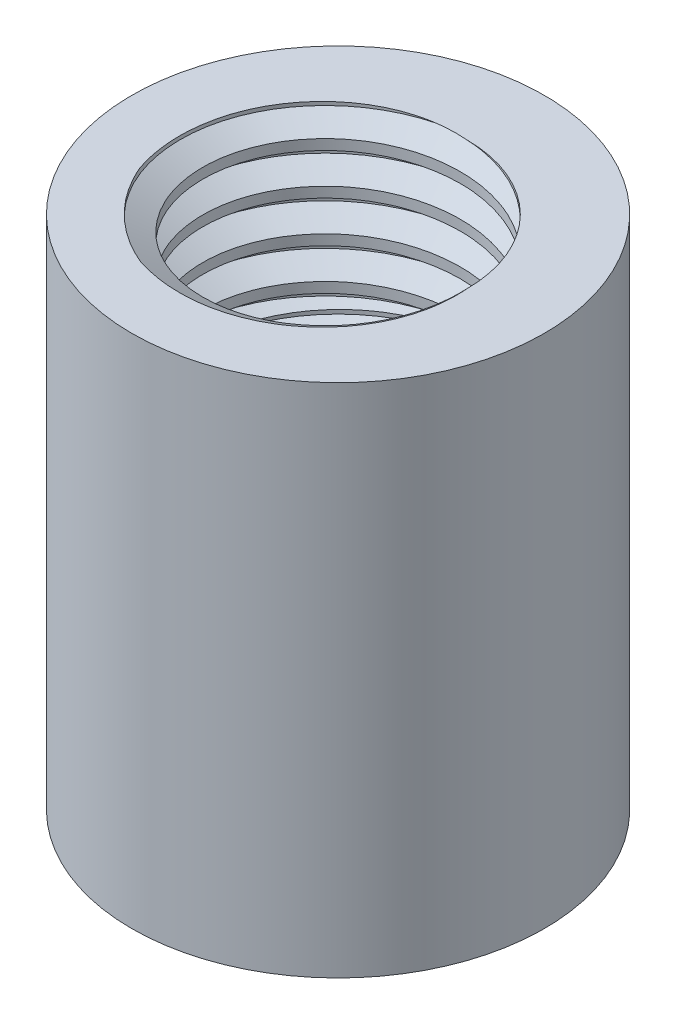
from build123d import *

# Parameters (mm, degrees)
SKETCH1_R           = 4
BOSS_EXTRUDE1_DEPTH = 10
SKETCH2_R           = 2.5
CUT_EXTRUDE1_DEPTH  = 4
THREAD1_PITCH       = 0.8
CUT_EXTRUDE2_START  = -4
CUT_EXTRUDE2_DEPTH  = 4


with BuildPart() as part:
    # Sketch1 → Boss-Extrude1 (new body)
    with BuildSketch(Plane(origin=(0, 0, 0), x_dir=(1, 0, 0), z_dir=(0, 1, 0))):
        with Locations(Location((0, 0, 0), (0, 0, 270))):
            Circle(SKETCH1_R)
    extrude(amount=BOSS_EXTRUDE1_DEPTH)

    # Sketch2 → Cut-Extrude1 (cut)
    with BuildSketch(Plane(origin=(0, 10, 0), x_dir=(1, 0, 0), z_dir=(0, 1, 0))):
        with Locations(Location((0, 0, 0), (0, 0, 270))):
            Circle(SKETCH2_R)
    extrude(amount=-CUT_EXTRUDE1_DEPTH, mode=Mode.SUBTRACT)

    # Thread1: the profile of Thread Profile1 profile screwed along a right-hand helix of 25 turns, 8 arcs to a turn; built about Z, then put on its axis
    thread1_z = Axis((0, 0, 0), (0, 0, 1))
    thread1_corners = [(2.4997, 0, -0.000173205), (2.9330127, 0, 0.249999999), (2.9330127, 0, 0.349999999), (2.4997, 0, 0.600173203)]
    with BuildLine(mode=Mode.PRIVATE) as thread1_profile:
        Line(thread1_corners[0], thread1_corners[1])
        Line(thread1_corners[1], thread1_corners[2])
        Line(thread1_corners[2], thread1_corners[3])
        Line(thread1_corners[3], thread1_corners[0])
    thread1_cap = Face(thread1_profile.wire())
    thread1_turn_angles = [0, 22.5, 45, 67.5, 90, 112.5, 135, 157.5, 180, 202.5, 225, 247.5, 270, 292.5, 315, 337.5, 360]
    thread1_turn_weights = [1, 0.9238795325112867, 1, 0.9238795325112867, 1, 0.9238795325112867, 1, 0.9238795325112867, 1, 0.9238795325112867, 1, 0.9238795325112867, 1, 0.9238795325112867, 1, 0.9238795325112867, 1]
    thread1_turn_rails = [Edge.make_bspline([Vector(p[0], p[1], 0).rotate(thread1_z, thread1_turn_angles[k]) / thread1_turn_weights[k] + Vector(0, 0, p[2] + THREAD1_PITCH * thread1_turn_angles[k] / 360) for k in range(17)], [0, 0, 0, 1, 1, 2, 2, 3, 3, 4, 4, 5, 5, 6, 6, 7, 7, 8, 8, 8], 2, thread1_turn_weights) for p in thread1_corners]
    thread1_turn_sides = [Face.make_surface_from_curves(thread1_turn_rails[p[0]], thread1_turn_rails[p[1]]) for p in [(0, 1), (1, 2), (2, 3), (3, 0)]]
    thread1 = Plane(origin=(0, 6, 0), x_dir=(1, 0, 0), z_dir=(0, 1, 0)) * Solid(Shell([*[p.moved(Location((0, 0, THREAD1_PITCH * i))) for i in range(25) for p in thread1_turn_sides], thread1_cap, thread1_cap.rotate(thread1_z, 9000).moved(Location((0, 0, THREAD1_PITCH * 9000 / 360)))]))
    add(thread1, mode=Mode.SUBTRACT)

    # Sketch5 → Cut-Revolve1 (revolve, cut)
    with BuildSketch(Plane(origin=(0, 0, 0), x_dir=(-1, 0, 0), z_dir=(0, 0, -1)), mode=Mode.PRIVATE) as cut_revolve1_sk:
        Polygon((-2.9330127, 6.349999999), (-2.9330127, 6.249999999), (-2.5, 6), (-2.5, 6.599999998), align=None)
    revolve(cut_revolve1_sk.sketch.rotate(Axis((0, 6, 0), (0, 1, 0)), 270), axis=Axis((0, 6, 0), (0, 1, 0)), mode=Mode.SUBTRACT)

    # Sketch6 → Cut-Extrude2 (cut)
    with BuildSketch(Plane.XZ.offset(CUT_EXTRUDE2_START)):
        with BuildLine():
            Line((1, 2.291287847), (1, -2.291287847))
            ThreePointArc((1, -2.291287847), (-2.5, 0), (1, 2.291287847))
        make_face()
    extrude(amount=CUT_EXTRUDE2_DEPTH, mode=Mode.SUBTRACT)


solid = part.part
